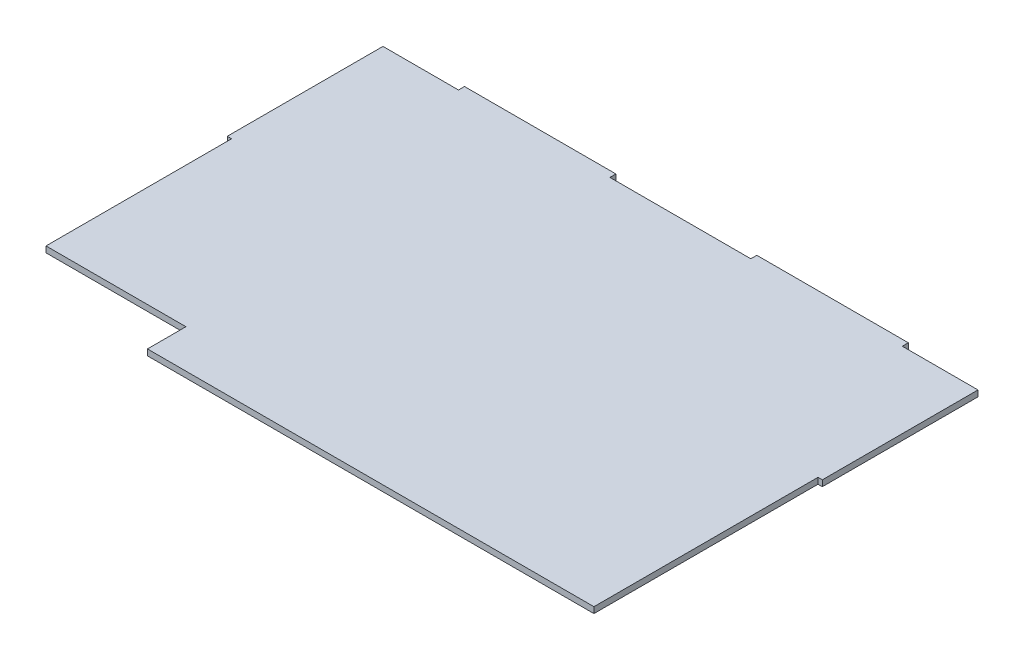
from build123d import *

# Parameters (mm, degrees)
SKETCH1_W           = 314.32961264
SKETCH1_H           = 3.175
BOSS_EXTRUDE1_DEPTH = 200.60000012
CUT_EXTRUDE2_START  = -3.175
SKETCH5_W           = 2.286
SKETCH5_H           = 118.364
CUT_EXTRUDE2_DEPTH  = 259.030286425
SKETCH6_W           = 73.914
SKETCH6_H           = 20.32
CUT_EXTRUDE4_DEPTH  = 255.855286425
SKETCH11_W          = 80
SKETCH11_H          = 3.175
BOSS_EXTRUDE4_DEPTH = 3.175


with BuildPart() as part:
    # Sketch1 → Boss-Extrude1 (new body)
    with BuildSketch(Plane.XY):
        Rectangle(SKETCH1_W, SKETCH1_H)
    extrude(amount=BOSS_EXTRUDE1_DEPTH)

    # Sketch5 → Cut-Extrude2 (cut)
    with BuildSketch(Plane(origin=(0, 1.5875, 0), x_dir=(1, 0, 0), z_dir=(0, 1, 0)).offset(CUT_EXTRUDE2_START)):
        with Locations((-156.02180632, -141.41800012)):
            Rectangle(SKETCH5_W, SKETCH5_H)
    cut_extrude2 = extrude(amount=CUT_EXTRUDE2_DEPTH, mode=Mode.SUBTRACT)

    # Mirror1: Cut-Extrude2 across plane
    add(cut_extrude2.mirror(Plane(origin=(0, 0, 0), x_dir=(0, 0, 1), z_dir=(1, 0, 0))), mode=Mode.SUBTRACT)

    # Sketch6 → Cut-Extrude4 (cut, through all)
    with BuildSketch(Plane(origin=(0, 1.5875, 0), x_dir=(1, 0, 0), z_dir=(0, 1, 0))):
        with Locations((-117.92180632, -190.44000012)):
            Rectangle(SKETCH6_W, SKETCH6_H)
    extrude(amount=-CUT_EXTRUDE4_DEPTH, mode=Mode.SUBTRACT)

    # Sketch11 → Boss-Extrude4 (add)
    with BuildSketch(Plane(origin=(0, 0, 0), x_dir=(-1, 0, 0), z_dir=(0, 0, -1))):
        with Locations((77.26519368, 0)):
            Rectangle(SKETCH11_W, SKETCH11_H)
        with Locations((-77.16680636, 0)):
            Rectangle(SKETCH11_W, SKETCH11_H)
    extrude(amount=BOSS_EXTRUDE4_DEPTH)


solid = part.part
